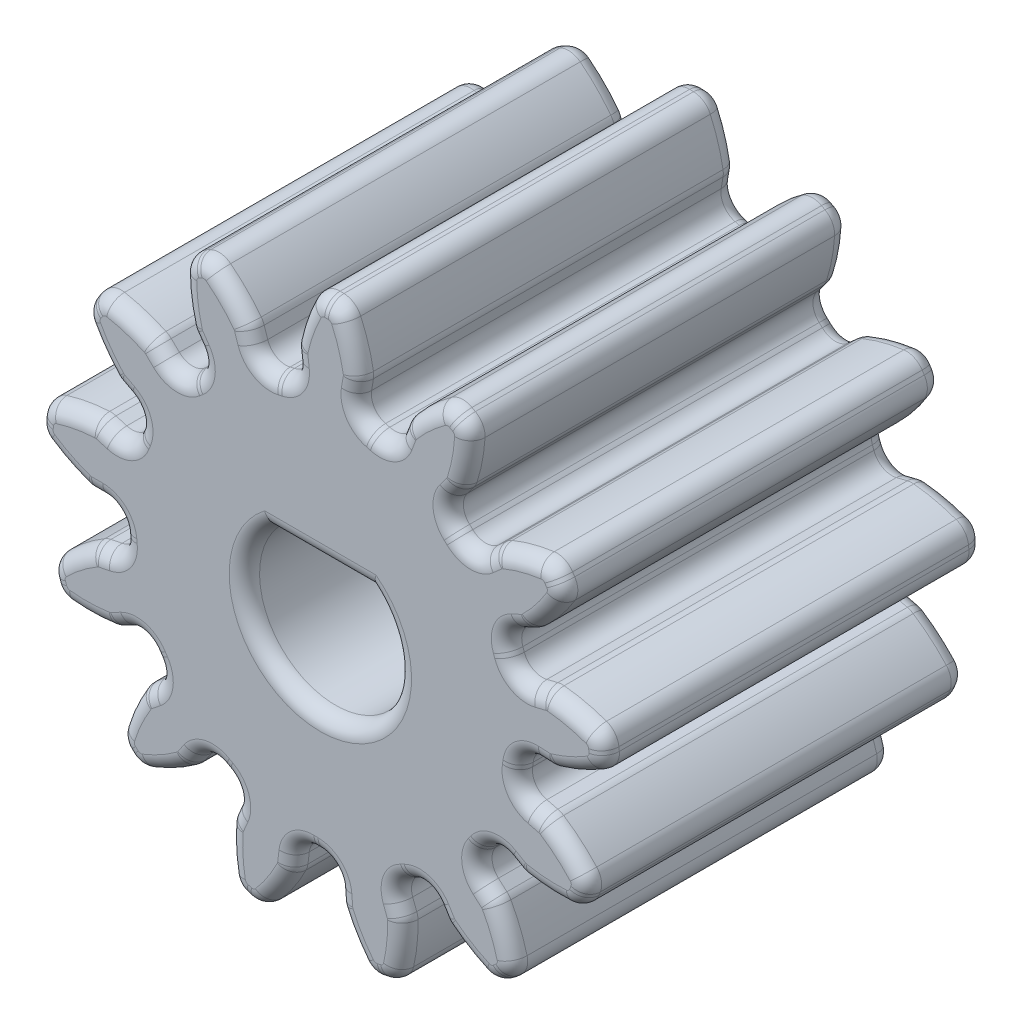
from build123d import *

# Parameters (mm, degrees)
SKETCH1_R                = 5.25
SKETCH1_R_2              = 1.5
BOSS_EXTRUDE5_DEPTH      = 10
BOSS_EXTRUDE8_DEPTH      = 10
CUT_EXTRUDE1_DEPTH       = 10
SKETCH5_R                = 3.6
BOSS_EXTRUDE7_DEPTH      = 1
FILLET6_R                = 0.5
CIRPATTERN1_COUNT        = 13
FILLET6_OF_CIRPATTERN1_R = 0.5
FILLET7_R                = 0.4


with BuildPart() as part:
    # Sketch1 → Boss-Extrude5 (new body)
    with BuildSketch(Plane(origin=(0, 0, 0), x_dir=(0, 1, 0), z_dir=(0, 0, 1))):
        with Locations(Location((0, 0, 0), (0, 0, 270))):
            Circle(SKETCH1_R)
        with Locations(Location((0, 0, 0), (0, 0, 270))):
            Circle(SKETCH1_R_2, mode=Mode.SUBTRACT)
    extrude(amount=BOSS_EXTRUDE5_DEPTH)

    # Sketch1<14> → Boss-Extrude8 (add)
    with BuildSketch(Plane(origin=(0, 0, 0), x_dir=(0, 1, 0), z_dir=(0, 0, 1))):
        with BuildLine():
            Line((1.487722909, 5.034796972), (1.730859915, 5.8576286))
            ThreePointArc((1.730859915, 5.8576286), (1.642075588, 6.623864084), (1.423624194, 7.363646797))
            ThreePointArc((1.423624194, 7.363646797), (1.073719407, 7.422743875), (0.721410905, 7.465223795))
            ThreePointArc((0.721410905, 7.465223795), (0.302277551, 6.817669391), (0, 6.108002035))
            Line((0, 6.108002035), (0, 5.25))
            ThreePointArc((0, 5.25), (0.751603585, 5.195920713), (1.487722909, 5.034796972))
        make_face()
    boss_extrude8 = extrude(amount=BOSS_EXTRUDE8_DEPTH)

    # Sketch4 → Cut-Extrude1 (cut)
    with BuildSketch(Plane.XY.offset(10)):
        with BuildLine():
            Line((-1.322875656, 1.5), (1.322875656, 1.5))
            ThreePointArc((1.322875656, 1.5), (0, -2), (-1.322875656, 1.5))
        make_face()
    extrude(amount=-CUT_EXTRUDE1_DEPTH, mode=Mode.SUBTRACT)

    # Sketch5 → Boss-Extrude7 (add)
    with BuildSketch(Plane(origin=(0, 0, 0), x_dir=(1, 0, 0), z_dir=(0, 0, -1))):
        Circle(SKETCH5_R)
        with BuildLine():
            Line((1.322875656, -1.5), (-1.322875656, -1.5))
            ThreePointArc((-1.322875656, -1.5), (0, 2), (1.322875656, -1.5))
        make_face(mode=Mode.SUBTRACT)
    extrude(amount=BOSS_EXTRUDE7_DEPTH)

    # Fillet6
    fillet6_edges = [part.edges().sort_by_distance(p)[0] for p in [
        (-5.8576286, 1.730859915, 5),
        (-7.363646797, 1.423624194, 5),
        (-7.465223795, 0.721410905, 5),
        (-6.108002035, 0, 5),
        (-5.25, 0, 5),
        (-5.034796972, 1.487722909, 5),
    ]]
    fillet(fillet6_edges, radius=FILLET6_R)

    # CirPattern1: Boss-Extrude8 ×13 about axis
    cirpattern1_axis = Axis((0, 0, 0), (0, 0, 1))
    for i in range(1, CIRPATTERN1_COUNT):
        add(boss_extrude8.rotate(cirpattern1_axis, i * 360 / CIRPATTERN1_COUNT))

    # Fillet6 of CirPattern1
    fillet6_of_cirpattern1_edges = [part.edges().sort_by_distance(p)[0] for p in [
        (-5.99104325, -1.189575402, 5),
        (-7.181776578, -2.161500677, 5),
        (-6.945383756, -2.830484849, 5),
        (-5.408367207, -2.838530081, 5),
        (-4.648644135, -2.439796653, 5),
        (-5.149470626, -1.022473605, 5),
        (-4.751982091, -3.837493331, 5),
        (-5.354647895, -5.251451791, 5),
        (-4.83444, -5.733950635, 5),
        (-3.469740629, -5.026787128, 5),
        (-2.98233992, -4.320665296, 5),
        (-4.084462617, -3.298433739, 5),
        (-2.424299103, -5.606287784, 5),
        (-2.30083391, -7.138358587, 5),
        (-1.615984301, -7.323837433, 5),
        (-0.736238288, -6.063467823, 5),
        (-0.632817571, -5.211721589, 5),
        (-2.083753446, -4.818762453, 5),
        (0.458761594, -6.090749269, 5),
        (1.280073396, -7.389953457, 5),
        (1.972673926, -7.235921336, 5),
        (2.165927372, -5.711081113, 5),
        (1.861675657, -4.908835274, 5),
        (0.394318527, -5.235170761, 5),
        (3.236725538, -5.179893498, 5),
        (4.567731314, -5.948599049, 5),
        (5.109416331, -5.490342864, 5),
        (4.571905173, -4.050354546, 5),
        (3.929681428, -3.481393956, 5),
        (2.782056878, -4.452264539, 5),
        (5.273194668, -3.082386551, 5),
        (6.808977035, -3.144492287, 5),
        (7.075653029, -2.486993007, 5),
        (5.930514597, -1.461740565, 5),
        (5.097444541, -1.256407238, 5),
        (4.532459526, -2.649398167, 5),
        (6.101638449, -0.278741992, 5),
        (7.490368174, 0.379979763, 5),
        (7.420942889, 1.086096976, 5),
        (5.930514597, 1.461740565, 5),
        (5.097444541, 1.256407238, 5),
        (5.244530318, -0.239586603, 5),
        (5.532270394, 2.588758998, 5),
        (6.455806233, 3.817403028, 5),
        (6.066184165, 4.410375231, 5),
        (4.571905173, 4.050354546, 5),
        (3.929681428, 3.481393956, 5),
        (4.755142418, 2.225111364, 5),
        (3.695525862, 4.8632065, 5),
        (3.942296885, 6.380305265, 5),
        (3.321735754, 6.724289671, 5),
        (2.165927372, 5.711081113, 5),
        (1.861675657, 4.908835274, 5),
        (3.176408696, 4.180063133, 5),
        (1.012180892, 6.023552001, 5),
        (0.525654831, 7.481556456, 5),
        (-0.183682286, 7.497750384, 5),
        (-0.736238288, 6.063467823, 5),
        (-0.632817571, 5.211721589, 5),
        (0.869998021, 5.177412814, 5),
        (-1.903042523, 5.803974329, 5),
        (-3.011408411, 6.868873225, 5),
        (-3.647020929, 6.553566842, 5),
        (-3.469740629, 5.026787128, 5),
        (-2.98233992, 4.320665296, 5),
        (-1.635718716, 4.988679613, 5),
        (-4.38230183, 4.254776085, 5),
        (-5.858594276, 4.682613918, 5),
        (-6.274871028, 4.108040115, 5),
        (-5.408367207, 2.838530081, 5),
        (-4.648644135, 2.439796653, 5),
        (-3.766712007, 3.657100033, 5),
    ]]
    fillet(fillet6_of_cirpattern1_edges, radius=FILLET6_OF_CIRPATTERN1_R)

    # Fillet7
    fillet7_edges = [part.edges().sort_by_distance(p)[0] for p in [
        (-0.519302342, -5.366923592, 0),
        (-0.519302342, -5.366923592, 10),
        (-2.260076319, -4.895467168, 0),
        (-2.260076319, -4.895467168, 10),
        (-5.100252868, -5.498856307, 0),
        (-5.100252868, -5.498856307, 10),
        (-2.545260437, -4.591747958, 0),
        (-3.338499585, -4.836651651, 0),
        (-4.023027035, -5.386449799, 0),
        (-5.069072457, -4.416230563, 0),
        (-4.572240965, -3.692342242, 0),
        (-4.748621623, -3.843838145, 0),
        (-3.476319921, -5.0239127, 0),
        (-4.815708123, -5.656538997, 0),
        (-5.278861835, -5.226958569, 0),
        (-5.069072457, -4.416230563, 10),
        (-4.572240965, -3.692342242, 10),
        (-4.023027035, -5.386449799, 10),
        (-3.338499585, -4.836651651, 10),
        (-2.545260437, -4.591747958, 10),
        (-4.748621623, -3.843838145, 10),
        (-3.476319921, -5.0239127, 10),
        (-4.815708123, -5.656538997, 10),
        (-5.278861835, -5.226958569, 10),
        (-2.953953144, -4.510843002, 0),
        (-2.953953144, -4.510843002, 10),
        (-4.276235226, -3.284411066, 0),
        (-4.276235226, -3.284411066, 10),
        (-7.07149558, -2.49878976, 0),
        (-7.07149558, -2.49878976, 10),
        (-4.387607867, -2.882949393, 0),
        (-5.203798672, -2.731164231, 0),
        (-6.065421566, -2.899870547, 0),
        (-6.540765428, -1.554662531, 0),
        (-5.764435312, -1.144580363, 0),
        (-5.991016286, -1.196755144, 0),
        (-5.412857067, -2.832927352, 0),
        (-6.892822521, -2.770645385, 0),
        (-7.103288787, -2.175032544, 0),
        (-6.540765428, -1.554662531, 10),
        (-5.764435312, -1.144580363, 10),
        (-6.065421566, -2.899870547, 10),
        (-5.203798672, -2.731164231, 10),
        (-4.387607867, -2.882949393, 10),
        (-5.991016286, -1.196755144, 10),
        (-5.412857067, -2.832927352, 10),
        (-6.892822521, -2.770645385, 10),
        (-7.103288787, -2.175032544, 10),
        (-4.711888879, -2.621382642, 0),
        (-4.711888879, -2.621382642, 10),
        (-5.312760177, -0.92093597, 0),
        (-5.312760177, -0.92093597, 10),
        (-6.073531002, 4.400252398, 0),
        (-6.073531002, 4.400252398, 10),
        (-4.865066189, 1.973228568, 0),
        (-5.203798672, 2.731164231, 0),
        (-5.832098839, 3.344429861, 0),
        (-4.995040436, 4.499795441, 0),
        (-4.216543657, 4.093841504, 0),
        (-4.388195324, 4.250675336, 0),
        (-5.406306783, 2.845407876, 0),
        (-6.19576593, 4.098775756, 0),
        (-5.825144637, 4.610332755, 0),
        (-4.995040436, 4.499795441, 10),
        (-4.216543657, 4.093841504, 10),
        (-5.832098839, 3.344429861, 10),
        (-5.203798672, 2.731164231, 10),
        (-4.865066189, 1.973228568, 10),
        (-4.388195324, 4.250675336, 10),
        (-5.406306783, 2.845407876, 10),
        (-6.19576593, 4.098775756, 10),
        (-5.825144637, 4.610332755, 10),
        (0, 1.5, 10),
        (-4.834013583, 2.388693459, 0),
        (-4.834013583, 2.388693459, 10),
        (0, -2, 10),
        (-3.77590721, 3.84916465, 0),
        (-3.77590721, 3.84916465, 10),
        (-3.332945371, 6.718740593, 0),
        (-3.332945371, 6.718740593, 10),
        (-3.390797133, 4.008116117, 0),
        (-3.338499585, 4.836651651, 0),
        (-3.609833006, 5.671657045, 0),
        (-2.331729442, 6.305682023, 0),
        (-1.831060979, 5.584442171, 0),
        (-1.910166666, 5.803082139, 0),
        (-3.464719944, 5.031919586, 0),
        (-3.581282205, 6.508601687, 0),
        (-3.015380957, 6.789326612, 0),
        (-2.331729442, 6.305682023, 10),
        (-1.831060979, 5.584442171, 10),
        (-3.609833006, 5.671657045, 10),
        (-3.338499585, 4.836651651, 10),
        (-3.390797133, 4.008116117, 10),
        (-1.910166666, 5.803082139, 10),
        (-3.464719944, 5.031919586, 10),
        (-3.581282205, 6.508601687, 10),
        (-3.015380957, 6.789326612, 10),
        (-3.170225254, 4.361561142, 0),
        (-3.170225254, 4.361561142, 10),
        (-1.554603785, 5.163017609, 0),
        (-1.554603785, 5.163017609, 10),
        (-3.6, 0, 0),
        (-3.6, 0, -1),
        (0, -2, -1),
        (0, 1.5, -1),
        (0.171177879, 7.498046288, 0),
        (0.171177879, 7.498046288, 10),
        (-1.139737317, 5.124792566, 0),
        (-0.708390477, 5.834120466, 0),
        (-0.560597934, 6.699575951, 0),
        (0.865752667, 6.667012845, 0),
        (0.973895702, 5.795714437, 0),
        (1.005458155, 6.02607276, 0),
        (-0.72940752, 6.06567916, 0),
        (-0.146369886, 7.427385409, 0),
        (0.485170161, 7.412967562, 0),
        (0.865752667, 6.667012845, 10),
        (0.973895702, 5.795714437, 10),
        (-0.560597934, 6.699575951, 10),
        (-0.708390477, 5.834120466, 10),
        (-1.139737317, 5.124792566, 10),
        (1.005458155, 6.02607276, 10),
        (-0.72940752, 6.06567916, 10),
        (-0.146369886, 7.427385409, 10),
        (0.485170161, 7.412967562, 10),
        (-0.780176525, 5.335247731, 0),
        (-0.780176525, 5.335247731, 10),
        (1.022840632, 5.294085455, 0),
        (1.022840632, 5.294085455, 10),
        (3.636086339, 6.559639939, 0),
        (3.636086339, 6.559639939, 10),
        (-7.422743875, 1.073719407, 0),
        (1.372422582, 5.067440799, 0),
        (2.084002352, 5.49506259, 0),
        (2.617063369, 6.192702745, 0),
        (3.864901274, 5.501011371, 0),
        (3.555744616, 4.679258371, 0),
        (3.69074463, 4.868562733, 0),
        (-7.422743875, 1.073719407, 10),
        (2.173003377, 5.709864739, 0),
        (3.322074009, 6.644644643, 0),
        (3.874574642, 6.338386979, 0),
        (3.864901274, 5.501011371, 10),
        (3.555744616, 4.679258371, 10),
        (2.617063369, 6.192702745, 10),
        (2.084002352, 5.49506259, 10),
        (1.372422582, 5.067440799, 10),
        (3.69074463, 4.868562733, 10),
        (2.173003377, 5.709864739, 10),
        (3.322074009, 6.644644643, 10),
        (3.874574642, 6.338386979, 10),
        (-5.224807211, -0.513701866, 0),
        (-5.876970195, 0, 0),
        (1.788601244, 5.086693361, 0),
        (1.788601244, 5.086693361, 10),
        (3.365964586, 4.212342123, 0),
        (-6.718301113, 0.2510341, 0),
        (3.365964586, 4.212342123, 10),
        (-6.514047863, 1.663059951, 0),
        (-5.636066999, 1.665391084, 0),
        (-5.860941316, 1.724490039, 0),
        (-6.109373891, 0.007047512, 0),
        (-7.390874347, 0.749969695, 0),
        (6.268011239, 4.118499133, 0),
        (6.268011239, 4.118499133, 10),
        (-7.300437881, 1.375167225, 0),
        (3.570177008, 3.849199415, 0),
        (4.398975358, 3.897152098, 0),
        (5.195186992, 4.267155971, 0),
        (5.978647575, 3.074794487, 0),
        (5.323015289, 2.490840604, 0),
        (5.530525988, 2.595723656, 0),
        (4.577605387, 4.045989116, 0),
        (-6.514047863, 1.663059951, 10),
        (6.029470785, 4.339695866, 0),
        (6.376360766, 3.811758326, 0),
        (5.978647575, 3.074794487, 10),
        (5.323015289, 2.490840604, 10),
        (5.195186992, 4.267155971, 10),
        (4.398975358, 3.897152098, 10),
        (3.570177008, 3.849199415, 10),
        (5.530525988, 2.595723656, 10),
        (4.577605387, 4.045989116, 10),
        (6.029470785, 4.339695866, 10),
        (6.376360766, 3.811758326, 10),
        (-5.224807211, -0.513701866, 10),
        (-5.636066999, 1.665391084, 10),
        (3.947632023, 3.672838843, 0),
        (3.947632023, 3.672838843, 10),
        (4.937986618, 2.165601976, 0),
        (-6.718301113, 0.2510341, 10),
        (4.937986618, 2.165601976, 10),
        (-5.876970195, 0, 10),
        (-5.860941316, 1.724490039, 10),
        (-6.109373891, 0.007047512, 10),
        (-7.390874347, 0.749969695, 10),
        (-7.300437881, 1.375167225, 10),
        (7.464010302, 0.733859809, 0),
        (7.464010302, 0.733859809, 10),
        (4.950046906, 1.749152832, 0),
        (5.706196122, 1.406451026, 0),
        (6.583155885, 1.364055188, 0),
        (6.722757768, -0.05582076, 0),
        (5.870847308, -0.268198728, 0),
        (6.103330493, -0.271764428, 0),
        (5.933533169, 1.455226147, 0),
        (7.355588466, 1.040575065, 0),
        (7.417399482, 0.411901776, 0),
        (6.722757768, -0.05582076, 10),
        (5.870847308, -0.268198728, 10),
        (6.583155885, 1.364055188, 10),
        (5.706196122, 1.406451026, 10),
        (4.950046906, 1.749152832, 10),
        (6.103330493, -0.271764428, 10),
        (5.933533169, 1.455226147, 10),
        (7.355588466, 1.040575065, 10),
        (7.417399482, 0.411901776, 10),
        (5.20230788, 1.417581209, 0),
        (5.20230788, 1.417581209, 10),
        (5.378775425, -0.377251486, 0),
        (5.378775425, -0.377251486, 10),
        (-5.390387656, -0.13139511, 0),
        (-5.390387656, -0.13139511, 10),
        (-5.132195797, 1.653514458, 0),
        (-5.132195797, 1.653514458, 10),
        (6.950094555, -2.818897954, 0),
        (6.950094555, -2.818897954, 10),
        (5.195920713, -0.751603585, 0),
        (5.706196122, -1.406451026, 0),
        (6.4630031, -1.851534199, 0),
        (5.926765174, -3.173648143, 0),
        (5.073738961, -2.965796964, 0),
        (5.277935534, -3.076994557, 0),
        (5.930160009, -1.468911595, 0),
        (6.996629475, -2.496928943, 0),
        (6.759201366, -3.082316506, 0),
        (5.926765174, -3.173648143, 10),
        (5.073738961, -2.965796964, 10),
        (6.4630031, -1.851534199, 10),
        (5.706196122, -1.406451026, 10),
        (5.195920713, -0.751603585, 10),
        (5.277935534, -3.076994557, 10),
        (5.930160009, -1.468911595, 10),
        (6.996629475, -2.496928943, 10),
        (6.759201366, -3.082316506, 10),
        (5.265197696, -1.162427196, 0),
        (5.265197696, -1.162427196, 10),
        (4.587351604, -2.833681179, 0),
        (4.587351604, -2.833681179, 10),
        (4.843995904, -5.725880167, 0),
        (4.843995904, -5.725880167, 10),
        (4.251471702, -3.080176678, 0),
        (4.398975358, -3.897152098, 0),
        (4.862254192, -4.642959415, 0),
        (3.773022104, -5.564430983, 0),
        (3.114298163, -4.983966857, 0),
        (3.243429151, -5.177322315, 0),
        (4.568258657, -4.056539393, 0),
        (5.034826989, -5.462416621, 0),
        (4.552551675, -5.870413222, 0),
        (3.773022104, -5.564430983, 10),
        (3.114298163, -4.983966857, 10),
        (4.862254192, -4.642959415, 10),
        (4.398975358, -3.897152098, 10),
        (4.251471702, -3.080176678, 10),
        (3.243429151, -5.177322315, 10),
        (4.568258657, -4.056539393, 10),
        (5.034826989, -5.462416621, 10),
        (4.552551675, -5.870413222, 10),
        (4.121894172, -3.47613754, 0),
        (4.121894172, -3.47613754, 10),
        (2.745020813, -4.640948663, 0),
        (2.745020813, -4.640948663, 10),
        (1.628196168, -7.321132238, 0),
        (1.628196168, -7.321132238, 10),
        (2.33306176, -4.703118415, 0),
        (2.084002352, -5.49506259, 0),
        (2.147621446, -6.370738583, 0),
        (0.75492514, -6.680469744, 0),
        (0.441409187, -5.860370006, 0),
        (0.465892237, -6.091587924, 0),
        (2.159824301, -5.714862903, 0),
        (1.919606317, -7.176530481, 0),
        (1.302967258, -7.313669016, 0),
        (0.75492514, -6.680469744, 10),
        (0.441409187, -5.860370006, 10),
        (2.147621446, -6.370738583, 10),
        (2.084002352, -5.49506259, 10),
        (2.33306176, -4.703118415, 10),
        (0.465892237, -6.091587924, 10),
        (2.159824301, -5.714862903, 10),
        (1.919606317, -7.176530481, 10),
        (1.302967258, -7.313669016, 10),
        (2.034314368, -4.993506665, 0),
        (2.034314368, -4.993506665, 10),
        (0.273838836, -5.385030738, 0),
        (0.273838836, -5.385030738, 10),
        (-1.960603689, -7.239201142, 0),
        (-1.960603689, -7.239201142, 10),
        (-0.119824515, -5.248632401, 0),
        (-0.708390477, -5.834120466, 0),
        (-1.059005492, -6.639058317, 0),
        (-2.436116076, -6.266093394, 0),
        (-2.332601314, -5.394233012, 0),
        (-2.418374974, -5.610344151, 0),
        (-0.743399775, -6.063980193, 0),
        (-1.635373029, -7.246587694, 0),
        (-2.245111254, -7.081451377, 0),
        (-2.436116076, -6.266093394, 10),
        (-2.332601314, -5.394233012, 10),
        (-1.059005492, -6.639058317, 10),
        (-0.708390477, -5.834120466, 10),
        (-0.119824515, -5.248632401, 10),
        (-2.418374974, -5.610344151, 10),
        (-0.743399775, -6.063980193, 10),
        (-1.635373029, -7.246587694, 10),
        (-2.245111254, -7.081451377, 10),
    ]]
    fillet(fillet7_edges, radius=FILLET7_R)


solid = part.part
